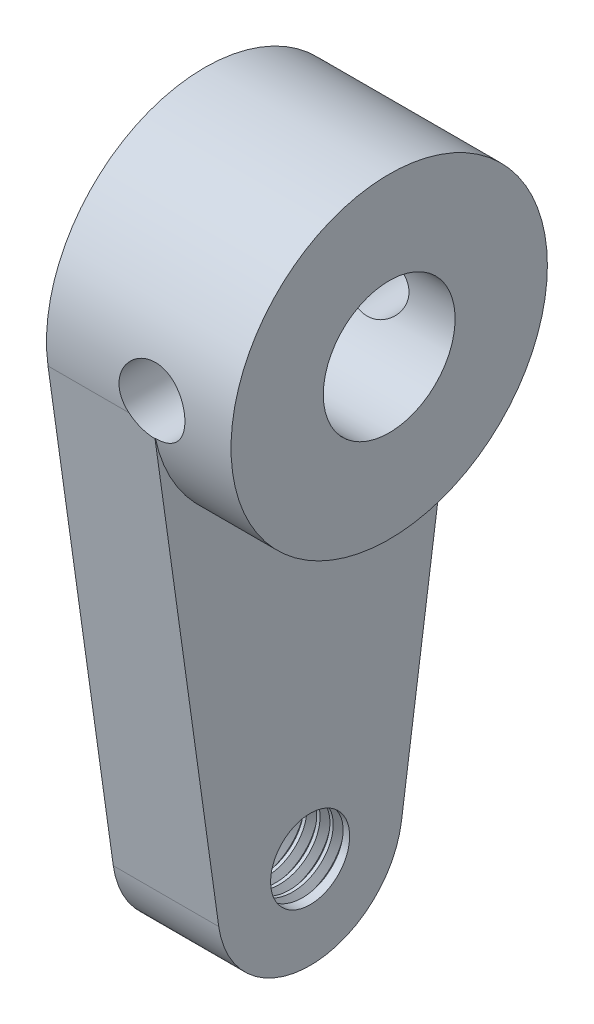
from build123d import *

# Parameters (mm, degrees)
BOSS_EXTRUDE1_DEPTH     = 4
SKETCH2_R               = 6
BOSS_EXTRUDE2_DEPTH     = 3
CUT_EXTRUDE1_DEPTH      = 24.393375131
CUT_EXTRUDE1_DEPTH_BACK = 24.393375131
SKETCH3_R               = 2.5
SKETCH3_R_2             = 1.5
THREAD1_PITCH           = 0.5
CUT_EXTRUDE2_DEPTH      = 24.393375248
CUT_EXTRUDE2_DEPTH_BACK = 24.393375248
SKETCH6_R               = 1.25


with BuildPart() as part:
    # Sketch1 → Boss-Extrude1 (new body)
    with BuildSketch(Plane(origin=(0, 0, 0), x_dir=(0, 0, -1), z_dir=(1, 0, 0))):
        with BuildLine():
            Line((5.941847823, -0.833333333), (3.466077897, -18.486111111))
            ThreePointArc((3.466077897, -18.486111111), (0, -21.5), (-3.466077897, -18.486111111))
            Line((-3.466077897, -18.486111111), (-5.941847823, -0.833333333))
            ThreePointArc((-5.941847823, -0.833333333), (0, 6), (5.941847823, -0.833333333))
        make_face()
    extrude(amount=BOSS_EXTRUDE1_DEPTH)

    # Sketch2 → Boss-Extrude2 (add)
    with BuildSketch(Plane(origin=(4, 0, 0), x_dir=(0, 0, -1), z_dir=(1, 0, 0))):
        with Locations(Location((0, 0, 0), (0, 0, 187.983556146))):
            Circle(SKETCH2_R)
    extrude(amount=BOSS_EXTRUDE2_DEPTH)

    # Sketch3 → Cut-Extrude1 (cut, two sides: drawn at the far end of the back side and taken through both)
    with BuildSketch(Plane.ZY.offset(-CUT_EXTRUDE1_DEPTH_BACK)):
        Circle(SKETCH3_R)
        with Locations((0, -18)):
            Circle(SKETCH3_R_2)
    extrude(amount=CUT_EXTRUDE1_DEPTH + CUT_EXTRUDE1_DEPTH_BACK, mode=Mode.SUBTRACT)

    # Thread1: the profile of Thread Profile1 profile screwed along a right-hand helix of 16 turns, 6 arcs to a turn; built about Z, then put on its axis
    thread1_z = Axis((0, 0, 0), (0, 0, 1))
    thread1_corners = [(1.4997, 0, -0.000173205), (1.770632937, 0, 0.156249999), (1.770632937, 0, 0.218749999), (1.4997, 0, 0.375173204)]
    with BuildLine(mode=Mode.PRIVATE) as thread1_profile:
        Line(thread1_corners[0], thread1_corners[1])
        Line(thread1_corners[1], thread1_corners[2])
        Line(thread1_corners[2], thread1_corners[3])
        Line(thread1_corners[3], thread1_corners[0])
    thread1_cap = Face(thread1_profile.wire())
    thread1_turn_angles = [0, 30, 60, 90, 120, 150, 180, 210, 240, 270, 300, 330, 360]
    thread1_turn_weights = [1, 0.8660254037844387, 1, 0.8660254037844387, 1, 0.8660254037844387, 1, 0.8660254037844387, 1, 0.8660254037844387, 1, 0.8660254037844387, 1]
    thread1_turn_rails = [Edge.make_bspline([Vector(p[0], p[1], 0).rotate(thread1_z, thread1_turn_angles[k]) / thread1_turn_weights[k] + Vector(0, 0, p[2] + THREAD1_PITCH * thread1_turn_angles[k] / 360) for k in range(13)], [0, 0, 0, 1, 1, 2, 2, 3, 3, 4, 4, 5, 5, 6, 6, 6], 2, thread1_turn_weights) for p in thread1_corners]
    thread1_turn_sides = [Face.make_surface_from_curves(thread1_turn_rails[p[0]], thread1_turn_rails[p[1]]) for p in [(0, 1), (1, 2), (2, 3), (3, 0)]]
    thread1 = Plane(origin=(4, -18, 0), x_dir=(0, 0, 1), z_dir=(-1, 0, 0)) * Solid(Shell([*[p.moved(Location((0, 0, THREAD1_PITCH * i))) for i in range(16) for p in thread1_turn_sides], thread1_cap, thread1_cap.rotate(thread1_z, 5760).moved(Location((0, 0, THREAD1_PITCH * 5760 / 360)))]))
    add(thread1, mode=Mode.SUBTRACT)

    # Sketch6 → Cut-Extrude2 (cut, two sides: drawn at the far end of the back side and taken through both)
    with BuildSketch(Plane.XY.offset(-CUT_EXTRUDE2_DEPTH_BACK)):
        with Locations((4, 0)):
            Circle(SKETCH6_R)
    extrude(amount=CUT_EXTRUDE2_DEPTH + CUT_EXTRUDE2_DEPTH_BACK, mode=Mode.SUBTRACT)


solid = part.part
